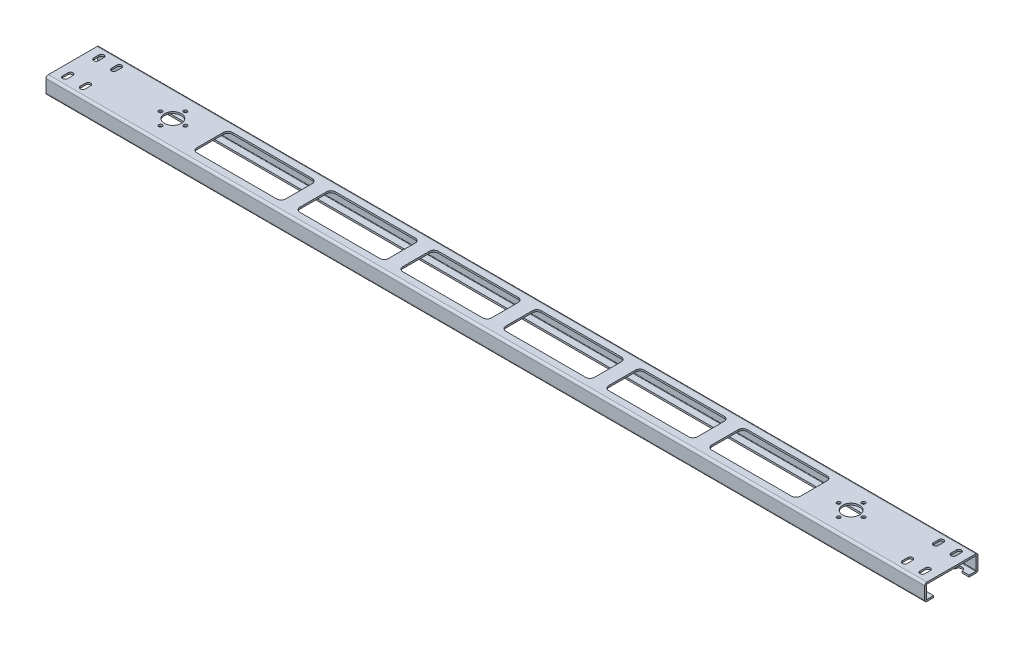
from build123d import *

# Parameters (mm, degrees)
SKETCH_1_W                       = 990
SKETCH_1_H                       = 2
SM_BASE_FLANGE_1_DEPTH           = 60
SM_EDGE_FLANGE_1_STRIP_W         = 9
SM_EDGE_FLANGE_1_STRIP_H         = 2
SM_EDGE_FLANGE_1_STRIP_CUT_DEPTH = 990
SM_EDGE_FLANGE_1_DEPTH           = 990
SM_EDGE_FLANGE_2_STRIP_W         = 9
SM_EDGE_FLANGE_2_STRIP_H         = 2
SM_EDGE_FLANGE_2_STRIP_CUT_DEPTH = 990
SM_EDGE_FLANGE_2_DEPTH           = 990
SM_EDGE_FLANGE_3_STRIP_W         = 9
SM_EDGE_FLANGE_3_STRIP_H         = 2
SM_EDGE_FLANGE_3_STRIP_CUT_DEPTH = 990
SM_EDGE_FLANGE_3_DEPTH           = 990
SM_EDGE_FLANGE_4_STRIP_W         = 9
SM_EDGE_FLANGE_4_STRIP_H         = 2
SM_EDGE_FLANGE_4_STRIP_CUT_DEPTH = 990
SM_EDGE_FLANGE_4_DEPTH           = 990
HOLE_WIZARD_19_0_19_1_D          = 19
HOLE_WIZARD_M4_1_D               = 4
PATTERN_LINEAR_1_COUNT           = 2
PATTERN_LINEAR_1_PITCH           = 764.04
CUT_EXTRUDE_1_DEPTH              = 2
PATTERN_LINEAR_2_COUNT           = 2
PATTERN_LINEAR_2_PITCH           = 20
PATTERN_LINEAR_2_COUNT_DIR2      = 2
PATTERN_LINEAR_2_PITCH_DIR2      = 35
CUT_EXTRUDE_4_DEPTH              = 2
MIRROR_1_COPY_1_DEPTH            = 2
MIRROR_1_COPY_2_DEPTH            = 2
MIRROR_1_COPY_3_DEPTH            = 2
CUT_EXTRUDE_2_DEPTH              = 2
PATTERN_LINEAR_3_COUNT           = 6
PATTERN_LINEAR_3_PITCH           = 116


# Sheet-metal steps are written as plain solids
with BuildPart() as part:
    # Sketch 1 → 基体-法兰1 (new body)
    with BuildSketch(Plane.XY):
        with Locations((0, -1)):
            Rectangle(SKETCH_1_W, SKETCH_1_H)
    extrude(amount=SM_BASE_FLANGE_1_DEPTH)

    # 边线-法兰1 strip (across the edge) → 边线-法兰1 strip cut (cut)
    with BuildSketch(Plane(origin=(-495, -2, 0), x_dir=(0, 0, 1), z_dir=(1, 0, 0))):
        with Locations((-2, -1)):
            Rectangle(SM_EDGE_FLANGE_1_STRIP_W, SM_EDGE_FLANGE_1_STRIP_H)
    extrude(amount=SM_EDGE_FLANGE_1_STRIP_CUT_DEPTH, mode=Mode.SUBTRACT)

    # 边线-法兰1 section (across the edge) → 边线-法兰1 (add)
    with BuildSketch(Plane(origin=(-495, -2, 0), x_dir=(0, 0, 1), z_dir=(1, 0, 0))):
        with BuildLine():
            Line((0, 0.5), (0, 15))
            Line((0, 15), (2, 15))
            Line((2, 15), (2, 0.5))
            ThreePointArc((2, 0.5), (2.146446609, 0.146446609), (2.5, 0))
            Line((2.5, 0), (2.5, -2))
            ThreePointArc((2.5, -2), (0.732233047, -1.267766953), (0, 0.5))
        make_face()
    extrude(amount=SM_EDGE_FLANGE_1_DEPTH)

    # 边线-法兰2 strip (across the edge) → 边线-法兰2 strip cut (cut)
    with BuildSketch(Plane(origin=(495, -2, 60), x_dir=(0, 0, -1), z_dir=(-1, 0, 0))):
        with Locations((-2, -1)):
            Rectangle(SM_EDGE_FLANGE_2_STRIP_W, SM_EDGE_FLANGE_2_STRIP_H)
    extrude(amount=SM_EDGE_FLANGE_2_STRIP_CUT_DEPTH, mode=Mode.SUBTRACT)

    # 边线-法兰2 section (across the edge) → 边线-法兰2 (add)
    with BuildSketch(Plane(origin=(495, -2, 60), x_dir=(0, 0, -1), z_dir=(-1, 0, 0))):
        with BuildLine():
            Line((0, 0.5), (0, 15))
            Line((0, 15), (2, 15))
            Line((2, 15), (2, 0.5))
            ThreePointArc((2, 0.5), (2.146446609, 0.146446609), (2.5, 0))
            Line((2.5, 0), (2.5, -2))
            ThreePointArc((2.5, -2), (0.732233047, -1.267766953), (0, 0.5))
        make_face()
    extrude(amount=SM_EDGE_FLANGE_2_DEPTH)

    # 边线-法兰3 strip (across the edge) → 边线-法兰3 strip cut (cut)
    with BuildSketch(Plane(origin=(495, -17, 58), x_dir=(0, 1, 0), z_dir=(-1, 0, 0))):
        with Locations((-4, -1)):
            Rectangle(SM_EDGE_FLANGE_3_STRIP_W, SM_EDGE_FLANGE_3_STRIP_H)
    extrude(amount=SM_EDGE_FLANGE_3_STRIP_CUT_DEPTH, mode=Mode.SUBTRACT)

    # 边线-法兰3 section (across the edge) → 边线-法兰3 (add)
    with BuildSketch(Plane(origin=(495, -17, 58), x_dir=(0, 1, 0), z_dir=(-1, 0, 0))):
        with BuildLine():
            Line((-2, 0.5), (-2, 8))
            Line((-2, 8), (0, 8))
            Line((0, 8), (0, 0.5))
            ThreePointArc((0, 0.5), (0.146446609, 0.146446609), (0.5, 0))
            Line((0.5, 0), (0.5, -2))
            ThreePointArc((0.5, -2), (-1.267766953, -1.267766953), (-2, 0.5))
        make_face()
    extrude(amount=SM_EDGE_FLANGE_3_DEPTH)

    # 边线-法兰4 strip (across the edge) → 边线-法兰4 strip cut (cut)
    with BuildSketch(Plane(origin=(-495, -17, 2), x_dir=(0, 1, 0), z_dir=(1, 0, 0))):
        with Locations((-4, -1)):
            Rectangle(SM_EDGE_FLANGE_4_STRIP_W, SM_EDGE_FLANGE_4_STRIP_H)
    extrude(amount=SM_EDGE_FLANGE_4_STRIP_CUT_DEPTH, mode=Mode.SUBTRACT)

    # 边线-法兰4 section (across the edge) → 边线-法兰4 (add)
    with BuildSketch(Plane(origin=(-495, -17, 2), x_dir=(0, 1, 0), z_dir=(1, 0, 0))):
        with BuildLine():
            Line((-2, 0.5), (-2, 8))
            Line((-2, 8), (0, 8))
            Line((0, 8), (0, 0.5))
            ThreePointArc((0, 0.5), (0.146446609, 0.146446609), (0.5, 0))
            Line((0.5, 0), (0.5, -2))
            ThreePointArc((0.5, -2), (-1.267766953, -1.267766953), (-2, 0.5))
        make_face()
    extrude(amount=SM_EDGE_FLANGE_4_DEPTH)

    # Ø19.0 (19) 直径孔1 (through all)
    with Locations(Plane.XZ.offset(2)):
        with Locations((-382.02, 30), (382.02, 30)):
            Hole(HOLE_WIZARD_19_0_19_1_D / 2)

    # M4 螺纹孔1 (through all)
    with Locations(Plane.XZ.offset(2)):
        with Locations((-396.02, 30), (-368.02, 30), (-382.02, 44), (-382.02, 16)):
            hole_wizard_m4_1 = Hole(HOLE_WIZARD_M4_1_D / 2)

    # 阵列(线性)1: M4 螺纹孔1 ×2
    with Locations(*[(i * PATTERN_LINEAR_1_PITCH, 0, 0) for i in range(1, PATTERN_LINEAR_1_COUNT)]):
        add(hole_wizard_m4_1, mode=Mode.SUBTRACT)

    # 草图19 → 切除-拉伸1 (cut)
    with BuildSketch(Plane(origin=(0, 0, 0), x_dir=(1, 0, 0), z_dir=(0, 1, 0))):
        with BuildLine():
            Line((460.249565443, -15.5), (460.249565443, -9.5))
            ThreePointArc((460.249565443, -9.5), (462.999565443, -6.75), (465.749565443, -9.5))
            Line((465.749565443, -9.5), (465.749565443, -15.5))
            ThreePointArc((465.749565443, -15.5), (462.999565443, -18.25), (460.249565443, -15.5))
        make_face()
    cut_extrude_1 = extrude(amount=-CUT_EXTRUDE_1_DEPTH, mode=Mode.SUBTRACT)

    # 阵列(线性)2: Cut-Extrude 1 2 × 2
    with Locations(*[(i * PATTERN_LINEAR_2_PITCH, 0, j * PATTERN_LINEAR_2_PITCH_DIR2) for i in range(PATTERN_LINEAR_2_COUNT) for j in range(PATTERN_LINEAR_2_COUNT_DIR2) if (i, j) != (0, 0)]):
        add(cut_extrude_1, mode=Mode.SUBTRACT)

    # 草图23 → 切除-拉伸4 (cut)
    with BuildSketch(Plane.XZ.offset(19)):
        with BuildLine():
            Line((466.999565443, 10), (458.999565443, 10))
            ThreePointArc((458.999565443, 10), (462.999565443, 6), (466.999565443, 10))
        make_face()
        with BuildLine():
            Line((486.999565443, 10), (478.999565443, 10))
            ThreePointArc((478.999565443, 10), (482.999565443, 6), (486.999565443, 10))
        make_face()
        with BuildLine():
            Line((486.999565443, 50), (478.999565443, 50))
            ThreePointArc((478.999565443, 50), (482.999565443, 54), (486.999565443, 50))
        make_face()
        with BuildLine():
            Line((466.999565443, 50), (458.999565443, 50))
            ThreePointArc((458.999565443, 50), (462.999565443, 54), (466.999565443, 50))
        make_face()
    cut_extrude_4 = extrude(amount=-CUT_EXTRUDE_4_DEPTH, mode=Mode.SUBTRACT)

    # 镜向1: 切除-拉伸1, 切除-拉伸4 across plane
    add(cut_extrude_1.mirror(Plane(origin=(0, 0, 0), x_dir=(0, 0, 1), z_dir=(1, 0, 0))), mode=Mode.SUBTRACT)
    add(cut_extrude_4.mirror(Plane(origin=(0, 0, 0), x_dir=(0, 0, 1), z_dir=(1, 0, 0))), mode=Mode.SUBTRACT)

    # 镜向1 copy 1 sketch → 镜向1 copy 1 (cut)
    with BuildSketch(Plane(origin=(0, 0, 35), x_dir=(-1, 0, 0), z_dir=(0, 1, 0))):
        with BuildLine():
            Line((460.249565443, 15.5), (460.249565443, 9.5))
            ThreePointArc((460.249565443, 9.5), (462.999565443, 6.75), (465.749565443, 9.5))
            Line((465.749565443, 9.5), (465.749565443, 15.5))
            ThreePointArc((465.749565443, 15.5), (462.999565443, 18.25), (460.249565443, 15.5))
        make_face()
    extrude(amount=-MIRROR_1_COPY_1_DEPTH, mode=Mode.SUBTRACT)

    # 镜向1 copy 2 sketch → 镜向1 copy 2 (cut)
    with BuildSketch(Plane(origin=(-20, 0, 0), x_dir=(-1, 0, 0), z_dir=(0, 1, 0))):
        with BuildLine():
            Line((460.249565443, 15.5), (460.249565443, 9.5))
            ThreePointArc((460.249565443, 9.5), (462.999565443, 6.75), (465.749565443, 9.5))
            Line((465.749565443, 9.5), (465.749565443, 15.5))
            ThreePointArc((465.749565443, 15.5), (462.999565443, 18.25), (460.249565443, 15.5))
        make_face()
    extrude(amount=-MIRROR_1_COPY_2_DEPTH, mode=Mode.SUBTRACT)

    # 镜向1 copy 3 sketch → 镜向1 copy 3 (cut)
    with BuildSketch(Plane(origin=(-20, 0, 35), x_dir=(-1, 0, 0), z_dir=(0, 1, 0))):
        with BuildLine():
            Line((460.249565443, 15.5), (460.249565443, 9.5))
            ThreePointArc((460.249565443, 9.5), (462.999565443, 6.75), (465.749565443, 9.5))
            Line((465.749565443, 9.5), (465.749565443, 15.5))
            ThreePointArc((465.749565443, 15.5), (462.999565443, 18.25), (460.249565443, 15.5))
        make_face()
    extrude(amount=-MIRROR_1_COPY_3_DEPTH, mode=Mode.SUBTRACT)

    # 草图20 → 切除-拉伸2 (cut)
    with BuildSketch(Plane(origin=(0, 0, 0), x_dir=(1, 0, 0), z_dir=(0, 1, 0))):
        with BuildLine():
            Line((-335, -10), (-245, -10))
            ThreePointArc((-245, -10), (-241.464466094, -11.464466094), (-240, -15))
            Line((-240, -15), (-240, -45))
            ThreePointArc((-240, -45), (-241.464466094, -48.535533906), (-245, -50))
            Line((-245, -50), (-335, -50))
            ThreePointArc((-335, -50), (-338.535533906, -48.535533906), (-340, -45))
            Line((-340, -45), (-340, -15))
            ThreePointArc((-340, -15), (-338.535533906, -11.464466094), (-335, -10))
        make_face()
    cut_extrude_2 = extrude(amount=-CUT_EXTRUDE_2_DEPTH, mode=Mode.SUBTRACT)

    # 阵列(线性)3: 切除-拉伸2 ×6
    with Locations(*[(i * PATTERN_LINEAR_3_PITCH, 0, 0) for i in range(1, PATTERN_LINEAR_3_COUNT)]):
        add(cut_extrude_2, mode=Mode.SUBTRACT)


solid = part.part
